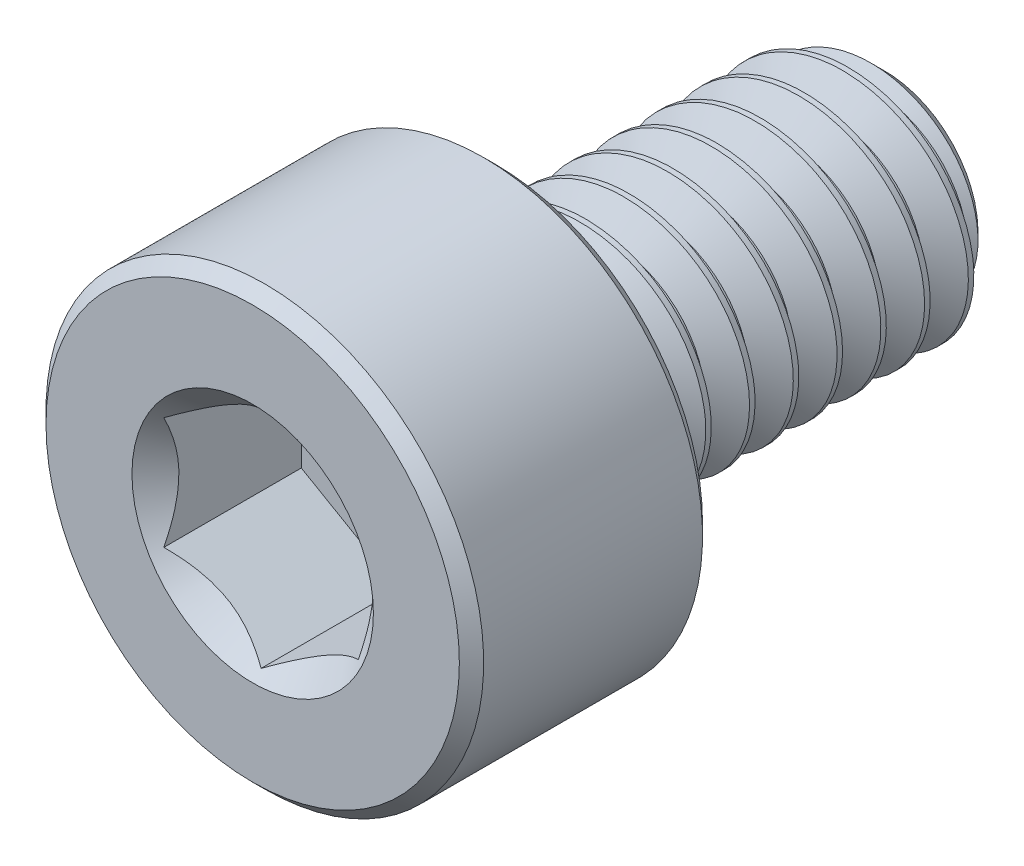
from build123d import *

# Parameters (mm, degrees)
CUT_EXTRUDE1_DEPTH     = 1.5
SPLIT1_SURFACE_1_BACK  = 10.097
SPLIT1_SURFACE_1_DEPTH = 20.194
SPLIT1_SURFACE_2_BACK  = 10.097
SPLIT1_SURFACE_2_DEPTH = 20.194
CUT_SWEEP1_PITCH       = 0.45


with BuildPart() as part:
    # Sketch2 → Revolve1 (revolve)
    with BuildSketch(Plane(origin=(0, 0, 0), x_dir=(0, 0, -1), z_dir=(1, 0, 0))):
        with BuildLine():
            Line((-3.25, 0), (-3.25, 2.125))
            Line((-3.25, 2.125), (-3.125, 2.25))
            Line((-3.125, 2.25), (-0.875, 2.25))
            Line((-0.875, 2.25), (-0.75, 2.125))
            Line((-0.75, 2.125), (-0.75, 1.375))
            ThreePointArc((-0.75, 1.375), (-0.713388348, 1.286611652), (-0.625, 1.25))
            Line((-0.625, 1.25), (2.957716426, 1.25))
            Line((2.957716426, 1.25), (3.25, 0.957716426))
            Line((3.25, 0.957716426), (3.25, 0))
            Line((3.25, 0), (-3.25, 0))
        make_face()
    revolve(axis=Axis((0, 0, -3.25), (0, 0, 1)))

    # Sketch3 → Cut-Extrude1 (cut)
    with BuildSketch(Plane.XY.offset(3.25)):
        Polygon((1, -0.577350269), (1, 0.577350269), (0, 1.154700538), (-1, 0.577350269), (-1, -0.577350269), (0, -1.154700538), align=None)
    extrude(amount=-CUT_EXTRUDE1_DEPTH, mode=Mode.SUBTRACT)

    # Cut-Extrude2 cone 1 section (through the dimple's axis) → Cut-Extrude2 (revolve, cut)
    with BuildSketch(Plane(origin=(0, 0, 3.25), x_dir=(0, -1, 0), z_dir=(1, 0, 0))):
        Polygon((0, 0), (1.241303079, 0), (0, 1.241303079), align=None)
    revolve(axis=Axis((0, 0, 3.25), (0, 0, -1)), mode=Mode.SUBTRACT)


with BuildPart() as body_2:
    # Split1: the piece behind the surface
    add(part.part)
    # Split1 surface: a surface, the sketch's curves swept straight by 20.194 mm
    with BuildLine(Plane(origin=(0, 0, 0), x_dir=(0, 0, -1), z_dir=(1, 0, 0)).offset(-SPLIT1_SURFACE_1_BACK), mode=Mode.PRIVATE) as split1_surface_1_path:
        Line((-0.625, -2.25), (-0.625, 2.25))
    split1_surface_1 = Shell.extrude(split1_surface_1_path.wire(), (1 * SPLIT1_SURFACE_1_DEPTH, 0 * SPLIT1_SURFACE_1_DEPTH, 0 * SPLIT1_SURFACE_1_DEPTH))
    split(bisect_by=split1_surface_1, keep=Keep.BOTTOM)

    # Cut-Sweep1: the profile of Sketch7 screwed along a right-hand helix of 9.888889 turns, 6 arcs to a turn; built about Z, then put on its axis
    cut_sweep1_z = Axis((0, 0, 0), (0, 0, 1))
    cut_sweep1_corners = [(1.274356964, 0, 0.0140625), (1.274356964, 0, -0.4078125), (0.957716426, 0, -0.225), (0.957716426, 0, -0.16875)]
    with BuildLine(mode=Mode.PRIVATE) as cut_sweep1_profile:
        Line(cut_sweep1_corners[0], cut_sweep1_corners[1])
        Line(cut_sweep1_corners[1], cut_sweep1_corners[2])
        Line(cut_sweep1_corners[2], cut_sweep1_corners[3])
        Line(cut_sweep1_corners[3], cut_sweep1_corners[0])
    cut_sweep1_cap = Face(cut_sweep1_profile.wire())
    cut_sweep1_turn_angles = [0, 30, 60, 90, 120, 150, 180, 210, 240, 270, 300, 330, 360]
    cut_sweep1_turn_weights = [1, 0.8660254037844387, 1, 0.8660254037844387, 1, 0.8660254037844387, 1, 0.8660254037844387, 1, 0.8660254037844387, 1, 0.8660254037844387, 1]
    cut_sweep1_turn_rails = [Edge.make_bspline([Vector(p[0], p[1], 0).rotate(cut_sweep1_z, cut_sweep1_turn_angles[k]) / cut_sweep1_turn_weights[k] + Vector(0, 0, p[2] + CUT_SWEEP1_PITCH * cut_sweep1_turn_angles[k] / 360) for k in range(13)], [0, 0, 0, 1, 1, 2, 2, 3, 3, 4, 4, 5, 5, 6, 6, 6], 2, cut_sweep1_turn_weights) for p in cut_sweep1_corners]
    cut_sweep1_turn_sides = [Face.make_surface_from_curves(cut_sweep1_turn_rails[p[0]], cut_sweep1_turn_rails[p[1]]) for p in [(0, 1), (1, 2), (2, 3), (3, 0)]]
    cut_sweep1_last_angles = [3240, 3270, 3300, 3330, 3360, 3390, 3420, 3450, 3480, 3510, 3540, 3550, 3560]
    cut_sweep1_last_weights = [1, 0.8660254037844387, 1, 0.8660254037844387, 1, 0.8660254037844387, 1, 0.8660254037844387, 1, 0.8660254037844387, 1, 0.984807753012206, 1]
    cut_sweep1_last_rails = [Edge.make_bspline([Vector(p[0], p[1], 0).rotate(cut_sweep1_z, cut_sweep1_last_angles[k]) / cut_sweep1_last_weights[k] + Vector(0, 0, p[2] + CUT_SWEEP1_PITCH * cut_sweep1_last_angles[k] / 360) for k in range(13)], [0, 0, 0, 1, 1, 2, 2, 3, 3, 4, 4, 5, 5, 6, 6, 6], 2, cut_sweep1_last_weights) for p in cut_sweep1_corners]
    cut_sweep1_last_sides = [Face.make_surface_from_curves(cut_sweep1_last_rails[p[0]], cut_sweep1_last_rails[p[1]]) for p in [(0, 1), (1, 2), (2, 3), (3, 0)]]
    cut_sweep1 = Plane(origin=(0, 0, -3.25), x_dir=(0, 1, 0), z_dir=(0, 0, 1)) * Solid(Shell([*[p.moved(Location((0, 0, CUT_SWEEP1_PITCH * i))) for i in range(9) for p in cut_sweep1_turn_sides], *cut_sweep1_last_sides, cut_sweep1_cap, cut_sweep1_cap.rotate(cut_sweep1_z, 3560).moved(Location((0, 0, CUT_SWEEP1_PITCH * 3560 / 360)))]))
    add(cut_sweep1, mode=Mode.SUBTRACT)


with BuildPart() as part_1:
    add(part.part)

    # Split1: split by a surface, the side it looks to stays
    # Split1 surface: a surface, the sketch's curves swept straight by 20.194 mm
    with BuildLine(Plane(origin=(0, 0, 0), x_dir=(0, 0, -1), z_dir=(1, 0, 0)).offset(-SPLIT1_SURFACE_2_BACK), mode=Mode.PRIVATE) as split1_surface_2_path:
        Line((-0.625, -2.25), (-0.625, 2.25))
    split1_surface_2 = Shell.extrude(split1_surface_2_path.wire(), (1 * SPLIT1_SURFACE_2_DEPTH, 0 * SPLIT1_SURFACE_2_DEPTH, 0 * SPLIT1_SURFACE_2_DEPTH))
    split(bisect_by=split1_surface_2, keep=Keep.TOP)

    add(body_2.part)  # Revolve2 merges body 2
    # Sketch8 → Revolve2 (revolve)
    with BuildSketch(Plane(origin=(0, 0, 0), x_dir=(0, 0, -1), z_dir=(1, 0, 0)), mode=Mode.PRIVATE) as revolve2_sk:
        Polygon((-0.75, 0), (-0.75, 1.25), (-0.625, 1.25), (0.096687836, 0), align=None)
    revolve(revolve2_sk.sketch.rotate(Axis((0, 0, -0.096687836), (0, 0, 1)), 270), axis=Axis((0, 0, -0.096687836), (0, 0, 1)))


solid = part_1.part
